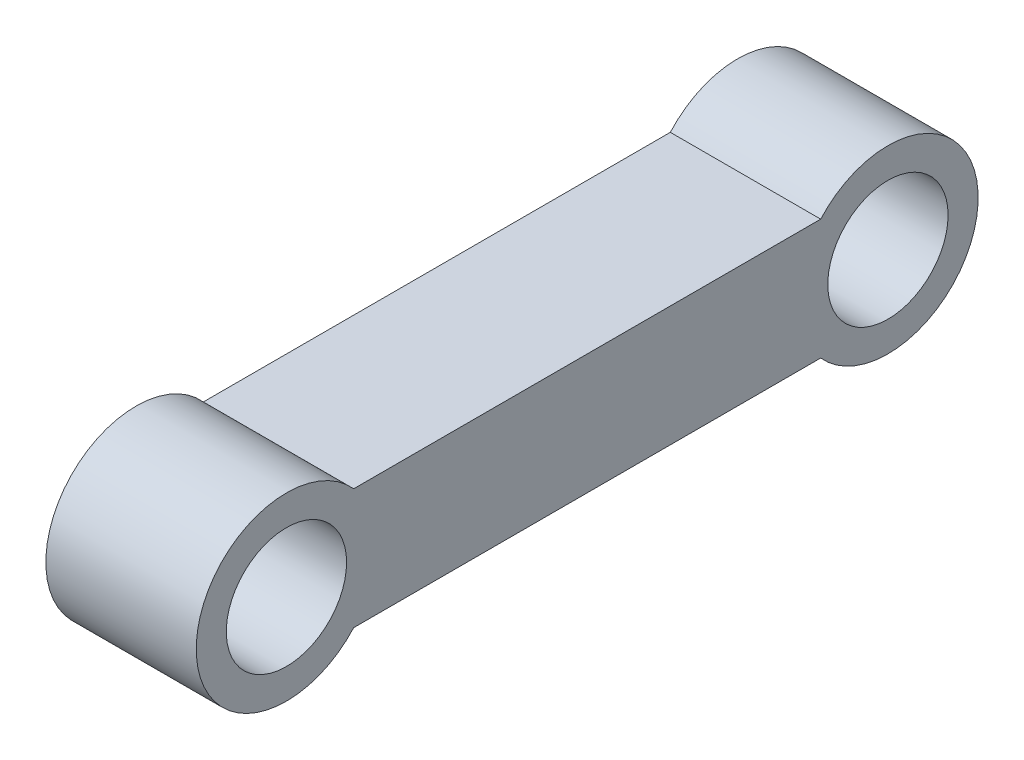
from build123d import *

# Parameters (mm, degrees)
LINKFRAME_R         = 40
BOSS_EXTRUDE1_DEPTH = 100


with BuildPart() as part:
    # LinkFrame → Boss-Extrude1 (new body)
    with BuildSketch(Plane(origin=(0, 0, 0), x_dir=(0, 0, -1), z_dir=(1, 0, 0))):
        with BuildLine():
            Line((-95.62417903, -186.263273145), (214.93310187, -186.263273145))
            ThreePointArc((214.93310187, -186.263273145), (319.65446142, -226.263273145), (214.93310187, -266.263273145))
            Line((214.93310187, -266.263273145), (-95.62417903, -266.263273145))
            ThreePointArc((-95.62417903, -266.263273145), (-200.34553858, -226.263273145), (-95.62417903, -186.263273145))
        make_face()
        with Locations((-140.34553858, -226.263273145)):
            Circle(LINKFRAME_R, mode=Mode.SUBTRACT)
        with Locations((259.65446142, -226.263273145)):
            Circle(LINKFRAME_R, mode=Mode.SUBTRACT)
    extrude(amount=BOSS_EXTRUDE1_DEPTH)


solid = part.part
